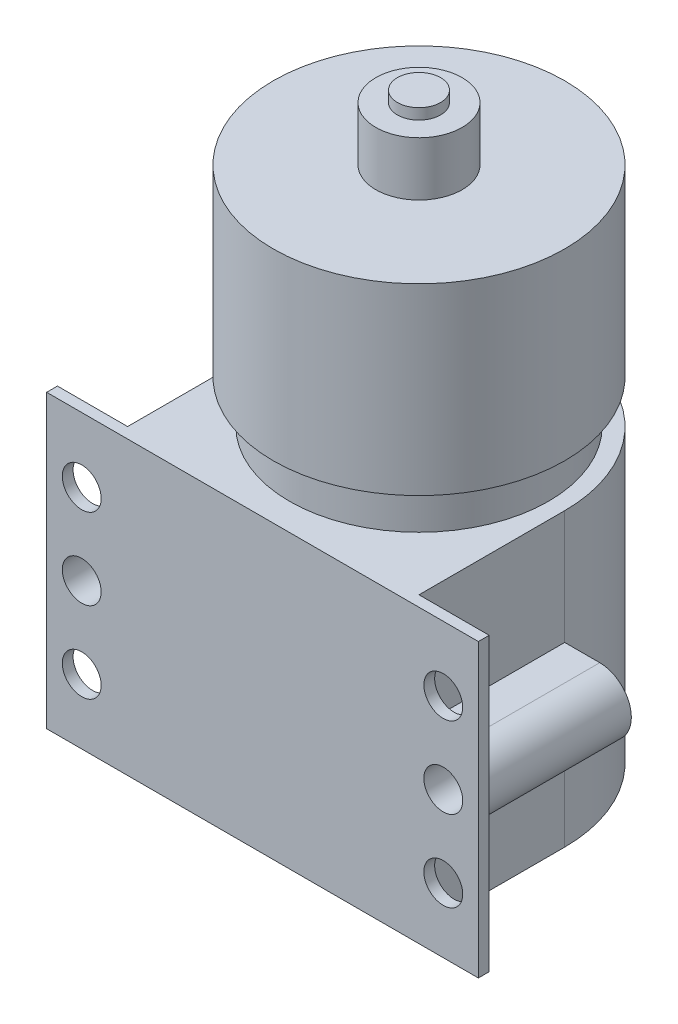
from build123d import *

# Parameters (mm, degrees)
EXTRUDE_7_DEPTH              = 27
EXTRUDE_9_DEPTH              = 13.5
EXTRUDE_10_DEPTH             = 13.5
EXTRUDE_START                = -27
SKETCH_9_R                   = 12
EXTRUDE_11_DEPTH             = 4
EXTRUDE_START_2              = -31
SKETCH_10_R                  = 13.5
EXTRUDE_12_DEPTH             = 17
EXTRUDE_START_3              = -48
SKETCH_11_R                  = 4
EXTRUDE_13_DEPTH             = 5
EXTRUDE_START_4              = -53
SKETCH_12_R                  = 2
EXTRUDE_14_DEPTH             = 1
HOLE_WIZARD_M3_1_D           = 3.6
HOLE_WIZARD_M3_1_ON_FACE_2_D = 3.6


with BuildPart() as part:
    # ｽｹｯﾁ1 → ﾎﾞｽ - 押し出し7 (new body)
    with BuildSketch(Plane(origin=(0, 0, 0), x_dir=(1, 0, 0), z_dir=(0, 1, 0))):
        with BuildLine():
            Line((13.5, -13.5), (13.5, 0))
            ThreePointArc((13.5, 0), (0, 13.5), (-13.5, 0))
            Line((-13.5, 0), (-13.5, -13.5))
            Line((-13.5, -13.5), (-20, -13.5))
            Line((-20, -13.5), (-20, -14.5))
            Line((-20, -14.5), (20, -14.5))
            Line((20, -14.5), (20, -13.5))
            Line((20, -13.5), (13.5, -13.5))
        make_face()
    extrude(amount=EXTRUDE_7_DEPTH)

    # ｽｹｯﾁ2 → ﾎﾞｽ - 押し出し9 (add)
    with BuildSketch(Plane(origin=(0, 0, 13.5), x_dir=(-1, 0, 0), z_dir=(0, 0, -1))):
        with BuildLine():
            Line((13.5, 10.575), (16.75, 10.575))
            ThreePointArc((16.75, 10.575), (19.675, 13.5), (16.75, 16.425))
            Line((16.75, 16.425), (13.5, 16.425))
            Line((13.5, 16.425), (13.5, 10.575))
        make_face()
    extrude(amount=EXTRUDE_9_DEPTH)

    # ｽｹｯﾁ3 → ﾎﾞｽ - 押し出し10 (add)
    with BuildSketch(Plane(origin=(0, 0, 13.5), x_dir=(-1, 0, 0), z_dir=(0, 0, -1))):
        with BuildLine():
            Line((-13.5, 16.425), (-16.75, 16.425))
            ThreePointArc((-16.75, 16.425), (-19.675, 13.5), (-16.75, 10.575))
            Line((-16.75, 10.575), (-13.5, 10.575))
            Line((-13.5, 10.575), (-13.5, 16.425))
        make_face()
    extrude(amount=EXTRUDE_10_DEPTH)

    # ｽｹｯﾁ9 → ﾎﾞｽ - 押し出し11 (add)
    with BuildSketch(Plane.XZ.offset(EXTRUDE_START)):
        Circle(SKETCH_9_R)
    extrude(amount=-EXTRUDE_11_DEPTH)

    # ｽｹｯﾁ10 → ﾎﾞｽ - 押し出し12 (add)
    with BuildSketch(Plane.XZ.offset(EXTRUDE_START_2)):
        Circle(SKETCH_10_R)
    extrude(amount=-EXTRUDE_12_DEPTH)

    # ｽｹｯﾁ11 → ﾎﾞｽ - 押し出し13 (add)
    with BuildSketch(Plane.XZ.offset(EXTRUDE_START_3)):
        Circle(SKETCH_11_R)
    extrude(amount=-EXTRUDE_13_DEPTH)

    # ｽｹｯﾁ12 → ﾎﾞｽ - 押し出し14 (add)
    with BuildSketch(Plane.XZ.offset(EXTRUDE_START_4)):
        Circle(SKETCH_12_R)
    extrude(amount=-EXTRUDE_14_DEPTH)

    # M3 すきま穴1 (through all)
    with Locations(Plane(origin=(16.75, 21, 13.5), x_dir=(-1, 0, 0), z_dir=(0, 0, -1))):
        with Locations((0, 0), (0, -15), (33.5, 0), (33.5, -15)):
            Hole(HOLE_WIZARD_M3_1_D / 2)

    # M3 すきま穴1 on face 2 (through all)
    with Locations(Plane(origin=(16.75, 13.5, 0), x_dir=(-1, 0, 0), z_dir=(0, 0, -1))):
        with Locations((0, 0), (33.5, 0)):
            Hole(HOLE_WIZARD_M3_1_ON_FACE_2_D / 2)


solid = part.part
